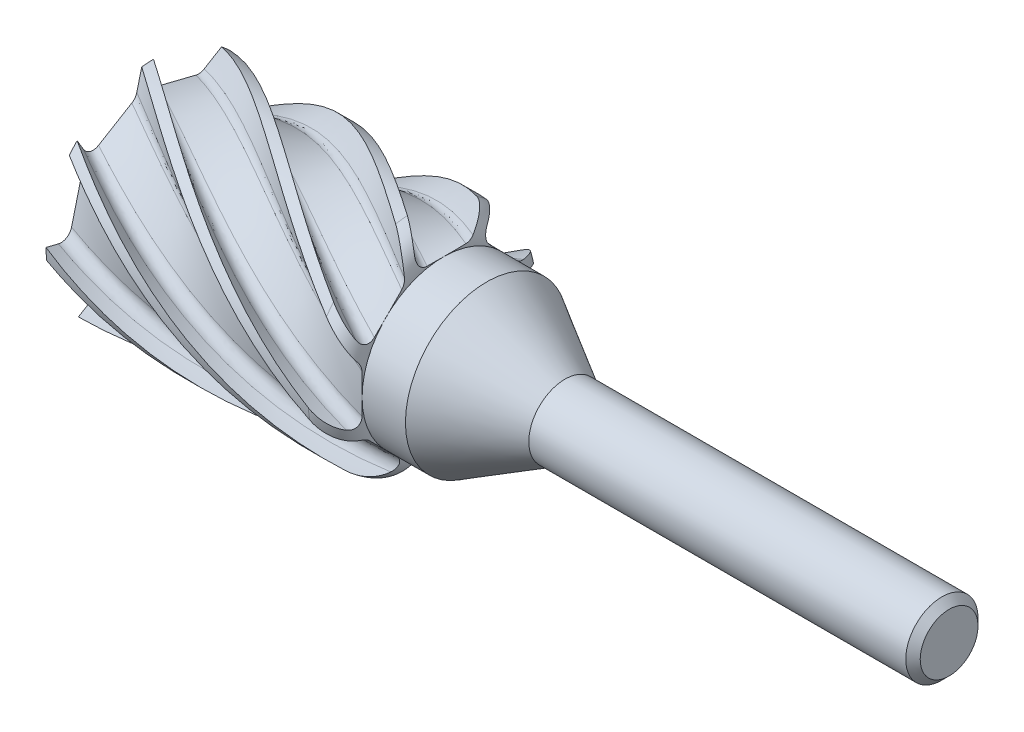
from build123d import *

# Parameters (mm, degrees)
CHAMFER1_SIZE          = 0.635
CUT_SWEEP1_PITCH       = 87.923076923
CUT_SWEEP1_HEIGHT      = 28.575
CUT_SWEEP1_RADIUS      = 9.525
CUT_SWEEP1_START_ANGLE = -90
CIRPATTERN1_COUNT      = 8


with BuildPart() as part:
    # Sketch2 → Revolve1 (revolve)
    with BuildSketch(Plane.XY, mode=Mode.PRIVATE) as revolve1_sk:
        Polygon((34.925, 0), (34.925, 3.175), (1.159076643, 3.175), (-5.715, 7.14375), (-9.525, 7.14375), (-9.525, 9.525), (-34.925, 9.525), (-34.925, 0), align=None)
    revolve(revolve1_sk.sketch.rotate(Axis((-34.925, 0, 0), (1, 0, 0)), 90), axis=Axis((-34.925, 0, 0), (1, 0, 0)))


with BuildPart() as body_2:
    # Split1: the piece on the far side of the plane
    add(part.part)
    split(bisect_by=Plane(origin=(-9.525, 0, 0), x_dir=(0, 0, 1), z_dir=(1, 0, 0)), keep=Keep.BOTTOM)

    # Cut-Sweep1: sweep along a helix
    with BuildLine() as cut_sweep1_path:
        add(Helix(CUT_SWEEP1_PITCH, CUT_SWEEP1_HEIGHT, CUT_SWEEP1_RADIUS, center=(-9.525, 0, 0), direction=(-1, 0, 0), mode=Mode.PRIVATE).rotate(Axis((-9.525, 0, 0), (-1, 0, 0)), CUT_SWEEP1_START_ANGLE))
    # Sketch4 → Cut-Sweep1 (sweep, cut)
    with BuildSketch(Plane(origin=(-9.525, 0, 0), x_dir=(0, 0, -1), z_dir=(1, 0, 0))):
        with BuildLine():
            Line((2.660230791, 7.422730791), (7.14375, 11.90625))
            Line((7.14375, 11.90625), (2.38125, 11.90625))
            Line((2.38125, 11.90625), (-2.38125, 11.90625))
            Line((-2.38125, 11.90625), (-2.38125, 8.09625))
            ThreePointArc((-2.38125, 8.09625), (-2.102269209, 7.422730791), (-1.42875, 7.14375))
            Line((-1.42875, 7.14375), (1.986711582, 7.14375))
            ThreePointArc((1.986711582, 7.14375), (2.351217551, 7.216254745), (2.660230791, 7.422730791))
        make_face()
    cut_sweep1 = sweep(path=cut_sweep1_path.line, is_frenet=True, mode=Mode.SUBTRACT)

    # CirPattern1: Cut-Sweep1 ×8 about axis
    cirpattern1_axis = Axis((-9.525, 0, 0), (-1, 0, 0))
    for i in range(1, CIRPATTERN1_COUNT):
        add(cut_sweep1.rotate(cirpattern1_axis, i * 360 / CIRPATTERN1_COUNT), mode=Mode.SUBTRACT)

    # Sketch10 → Cut-Revolve1 (revolve, cut)
    with BuildSketch(Plane.XY):
        with BuildLine():
            ThreePointArc((-9.525, 7.14375), (-10.222451977, 8.827548023), (-11.90625, 9.525))
            Line((-11.90625, 9.525), (-9.525, 9.525))
            Line((-9.525, 9.525), (-9.525, 7.14375))
        make_face()
    revolve(axis=Axis((0, 0, 0), (-1, 0, 0)), mode=Mode.SUBTRACT)


with BuildPart() as part_1:
    add(part.part)

    # Split1
    split(bisect_by=Plane(origin=(-9.525, 0, 0), x_dir=(0, 0, 1), z_dir=(1, 0, 0)), keep=Keep.TOP)

    # Chamfer1
    chamfer1_edges = [part_1.edges().sort_by_distance(p)[0] for p in [
        (34.925, 0, -3.175),
    ]]
    chamfer(chamfer1_edges, length=CHAMFER1_SIZE)


solid = Compound([body_2.part, part_1.part])
